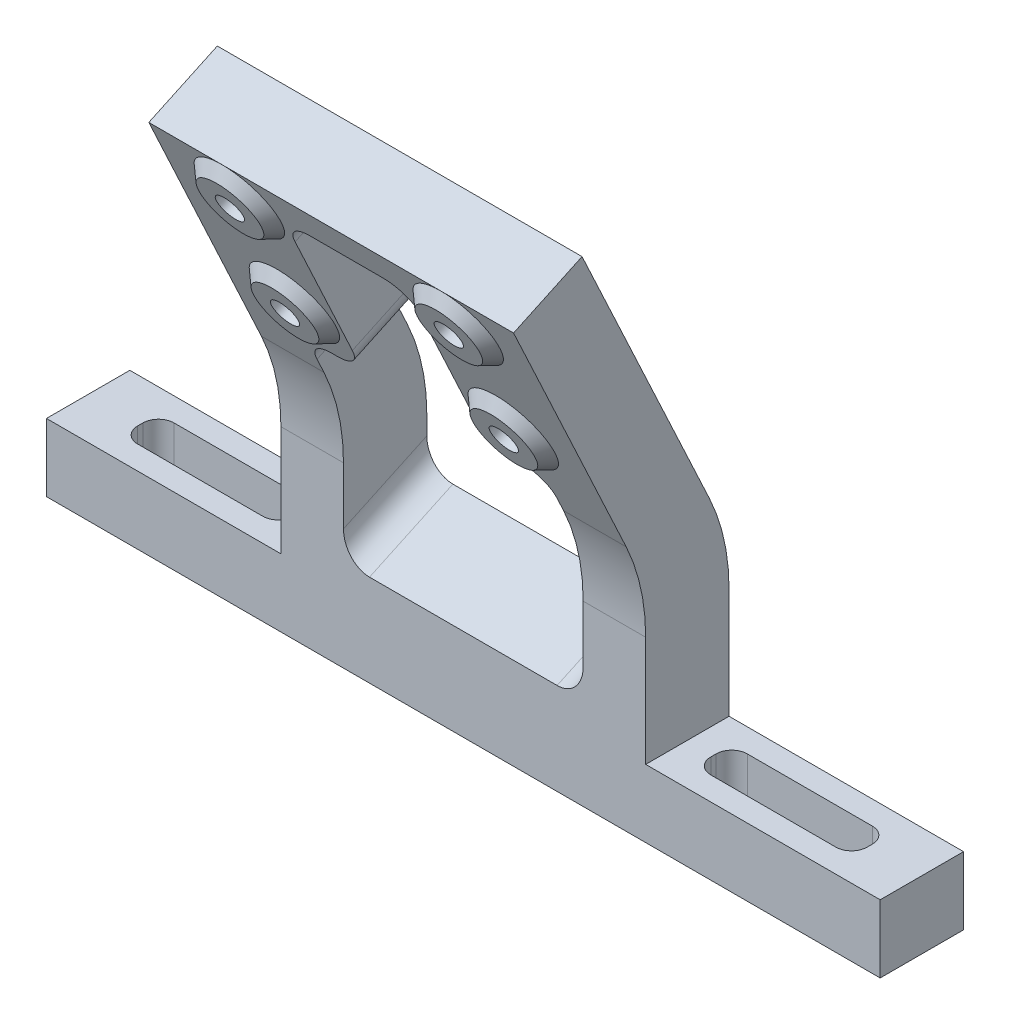
from build123d import *

# Parameters (mm, degrees)
SKETCH13_W              = 80
SKETCH13_H              = 8
BOSS_EXTRUDE9_DEPTH     = 6.5
SKETCH14_W              = 15
SKETCH14_H              = 3.4999999999999996
CUT_EXTRUDE1_DEPTH      = 41.72161588149469
SKETCH15_W              = 35
SKETCH15_H              = 8
BOSS_EXTRUDE10_DEPTH    = 15
BOSS_EXTRUDE11_DEPTH    = 35
SKETCH17_R              = 3.0000000000000036
SKETCH17_R_2            = 3
BOSS_EXTRUDE12_DEPTH    = 1
SKETCH20_R              = 1.3000000000000023
CUT_EXTRUDE2_DEPTH      = 68.35348577458582
CUT_EXTRUDE3_DEPTH      = 68.33334117794962
CUT_EXTRUDE3_DEPTH_BACK = 68.33334117794962
CUT_EXTRUDE4_DEPTH      = 68.3333411779496
FILLET2_R               = 1.5
CHAMFER1_SIZE           = 1
FILLET3_R               = 20
FILLET4_R               = 2.5


with BuildPart() as part:
    # Sketch13 → Boss-Extrude9 (new body)
    with BuildSketch(Plane(origin=(0, 0, 0), x_dir=(1, 0, 0), z_dir=(0, 1, 0))):
        Rectangle(SKETCH13_W, SKETCH13_H)
    extrude(amount=BOSS_EXTRUDE9_DEPTH)

    # Sketch14 → Cut-Extrude1 (cut, through all)
    with BuildSketch(Plane(origin=(0, 6.5, 0), x_dir=(1, 0, 0), z_dir=(0, 1, 0))):
        Polygon((-35, -1.75), (-20, -1.7499999999999998), (-20, 1.7499999999999998), (-35, 1.75), align=None)
        with Locations((27.5, 0)):
            Rectangle(SKETCH14_W, SKETCH14_H)
    extrude(amount=-CUT_EXTRUDE1_DEPTH, mode=Mode.SUBTRACT)

    # Sketch15 → Boss-Extrude10 (add)
    with BuildSketch(Plane(origin=(0, 6.5, 0), x_dir=(1, 0, 0), z_dir=(0, 1, 0))):
        Rectangle(SKETCH15_W, SKETCH15_H)
    extrude(amount=BOSS_EXTRUDE10_DEPTH)

    # Sketch16 → Boss-Extrude11 (add)
    with BuildSketch(Plane.ZY.offset(17.5)):
        Polygon((4, 21.5), (16.678547852220913, 48.689233611099525), (10.107397413474738, 51.75341138357542), (-4, 21.5), align=None)
    extrude(amount=-BOSS_EXTRUDE11_DEPTH)

    # Sketch17 → Boss-Extrude12 (add)
    with BuildSketch(Plane(origin=(0, 2.307944309631712, -4.949402544155895), x_dir=(1, 0, 0), z_dir=(0, -0.42261826174069717, 0.9063077870366509))):
        with Locations(Location((-10.500000000000005, 47.17609046825079, 0), (0, 0, 90))):
            Circle(SKETCH17_R)
        with Locations(Location((10.499999999999995, 47.17609046825079, 0), (0, 0, 90))):
            Circle(SKETCH17_R_2)
        with Locations(Location((10.499999999999995, 34.67609046825079, 0), (0, 0, 90))):
            Circle(SKETCH17_R_2)
        with Locations(Location((-10.500000000000005, 34.67609046825079, 0), (0, 0, 90))):
            Circle(SKETCH17_R)
    extrude(amount=BOSS_EXTRUDE12_DEPTH)

    # Sketch20 → Cut-Extrude2 (cut, through all)
    with BuildSketch(Plane(origin=(0, 1.885326047891013, -4.043094757119239), x_dir=(1, 0, 0), z_dir=(0, -0.4226182617406972, 0.906307787036651))):
        with Locations(Location((-10.500000000000005, 47.176090468250806, 0), (0, 0, 270))):
            Circle(SKETCH20_R)
        with Locations(Location((10.499999999999995, 47.176090468250806, 0), (0, 0, 270))):
            Circle(SKETCH20_R)
        with Locations(Location((10.499999999999995, 34.67609046825079, 0), (0, 0, 270))):
            Circle(SKETCH20_R)
        with Locations(Location((-10.500000000000005, 34.67609046825079, 0), (0, 0, 270))):
            Circle(SKETCH20_R)
    extrude(amount=-CUT_EXTRUDE2_DEPTH, mode=Mode.SUBTRACT)

    # Sketch21 → Cut-Extrude3 (cut, two sides: drawn at the far end of the back side and taken through both)
    with BuildSketch(Plane(origin=(0, 2.307944309631711, -4.949402544155892), x_dir=(1, 0, 0), z_dir=(0, -0.4226182617406972, 0.906307787036651)).offset(-CUT_EXTRUDE3_DEPTH_BACK)):
        Polygon((-11.500000000000002, 9.676090468250791), (11.499999999999998, 9.676090468250791), (11.499999999999995, 29.67609046825079), (-11.500000000000002, 29.67609046825079), align=None)
    extrude(amount=CUT_EXTRUDE3_DEPTH + CUT_EXTRUDE3_DEPTH_BACK, mode=Mode.SUBTRACT)

    # Sketch22 → Cut-Extrude4 (cut, through all)
    with BuildSketch(Plane(origin=(0, 2.307944309631712, -4.949402544155895), x_dir=(1, 0, 0), z_dir=(0, -0.42261826174069717, 0.9063077870366509))):
        Polygon((-6.000000000000002, 47.676090468250806), (6.000000000000002, 47.676090468250806), (6, 29.676090468250802), (-6, 29.676090468250802), align=None)
    extrude(amount=-CUT_EXTRUDE4_DEPTH, mode=Mode.SUBTRACT)

    # Fillet2
    fillet2_edges = [part.edges().sort_by_distance(p)[0] for p in [
        (-20, 3.25, -1.7499999999999998),
        (-20, 3.25, 1.7499999999999998),
        (-35, 3.25, 1.75),
        (-35, 3.25, -1.75),
        (35, 3.25, -1.7499999999999998),
        (35, 3.25, 1.7499999999999998),
        (20, 3.25, 1.7499999999999998),
        (20, 3.25, -1.7499999999999998),
    ]]
    fillet(fillet2_edges, radius=FILLET2_R)

    # Chamfer1
    chamfer1_edges = [part.edges().sort_by_distance(p)[0] for p in [
        (10.499999999999995, 42.345079101842984, 13.720220020036038),
        (10.499999999999995, 31.016231763884843, 8.437491748277322),
        (-10.500000000000005, 42.345079101842984, 13.720220020036038),
        (-10.500000000000005, 31.01623176388484, 8.43749174827732),
    ]]
    chamfer(chamfer1_edges, length=CHAMFER1_SIZE - 0.0001)  # a hair under: the kernel refuses the full size

    # Fillet3
    fillet3_edges = [part.edges().sort_by_distance(p)[0] for p in [
        (14.5, 21.5, 4),
        (-14.5, 21.5, -4),
        (14.499999999999998, 21.5, -4),
        (-14.5, 21.5, 4),
    ]]
    fillet(fillet3_edges, radius=FILLET3_R)

    # Fillet4
    fillet4_edges = [part.edges().sort_by_distance(p)[0] for p in [
        (11.499999999999998, 10.676384564551352, 0),
        (11.499999999999995, 30.735705076049488, 4.306680005422848),
        (-11.500000000000002, 10.676384564551352, -7.11e-15),
        (-11.500000000000002, 30.735705076049495, 4.306680005422834),
        (-6, 30.7357050760495, 4.306680005422846),
        (6, 30.7357050760495, 4.306680005422846),
        (6.000000000000002, 47.049245242709226, 11.913808716755398),
        (-6.000000000000002, 47.049245242709226, 11.913808716755398),
    ]]
    fillet(fillet4_edges, radius=FILLET4_R)


solid = part.part
